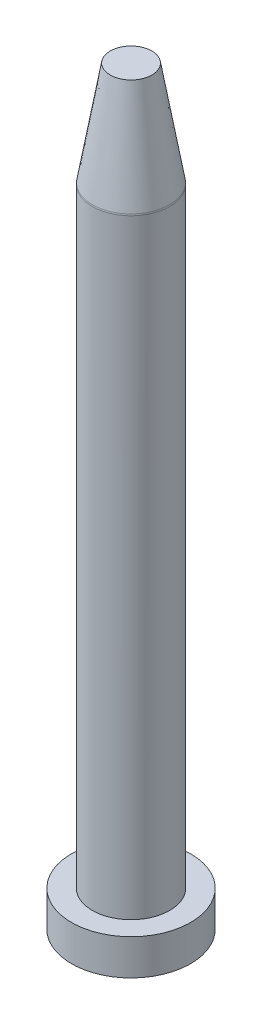
from build123d import *

# Parameters (mm, degrees)
FILLET_1_R = 3


with BuildPart() as part:
    # 草图1 → Revolve 295 (revolve)
    with BuildSketch(Plane.XY):
        Polygon((0, 0), (20, 0), (20, 12), (13, 12), (13, 217), (7, 252), (0, 252), align=None)
    revolve(axis=Axis((0, 0, 0), (0, 1, 0)))

    # 圆角1
    fillet_1_edges = [part.edges().sort_by_distance(p)[0] for p in [
        (-13, 217, 0),
    ]]
    fillet(fillet_1_edges, radius=FILLET_1_R)


solid = part.part
